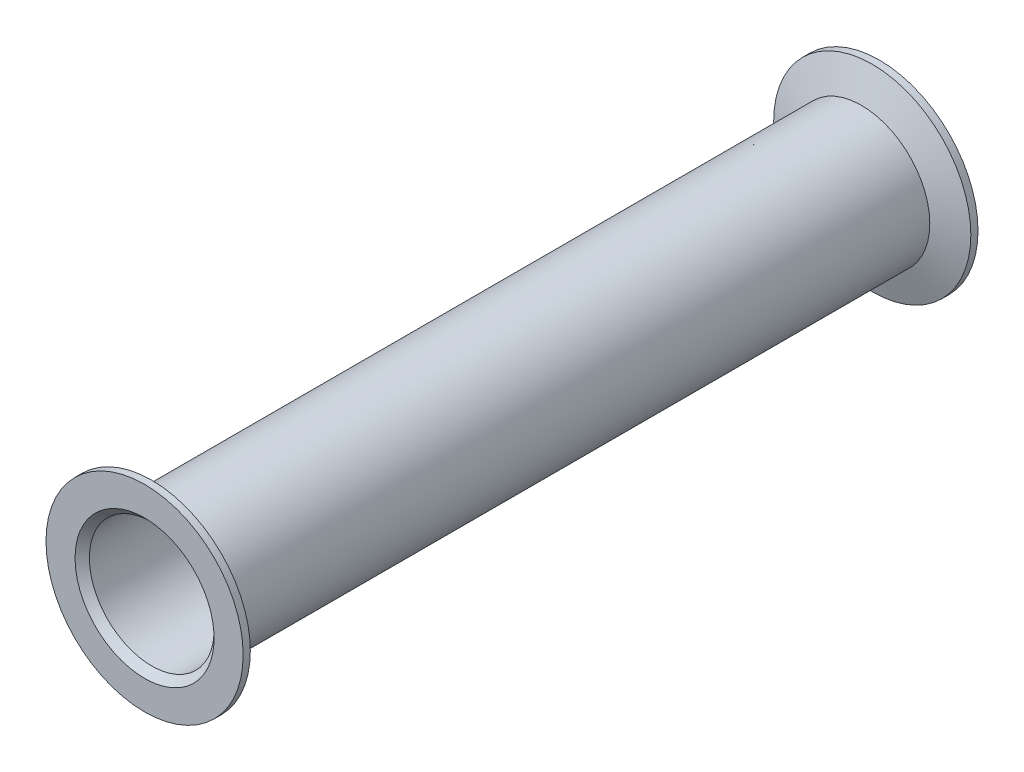
from build123d import *

# Parameters (mm, degrees)
SKETCH_3_R          = 19.05
SKETCH_3_R_2        = 17.4
EXTRUDE_1_DEPTH     = 97.5
SKETCH_5_R          = 17.4
CUT_EXTRUDE_1_DEPTH = 209.656416149
CHAMFER_1_SIZE      = 2


with BuildPart() as part:
    # 스케치3 → 보스-돌출1 (new, symmetric)
    with BuildSketch(Plane.XY):
        Circle(SKETCH_3_R)
        Circle(SKETCH_3_R_2, mode=Mode.SUBTRACT)
    extrude(amount=EXTRUDE_1_DEPTH, both=True)

    # 스케치4 → 회전1 (revolve)
    with BuildSketch(Plane(origin=(0, 0, 0), x_dir=(0, 0, -1), z_dir=(1, 0, 0))):
        Polygon((102.5, 0), (102.5, 27.5), (100.5, 27.5), (97.5, 19.05), (97.5, 0), align=None)
        Polygon((-102.5, 0), (-97.5, 0), (-97.5, 19.05), (-100.5, 27.5), (-102.5, 27.5), align=None)
    revolve(axis=Axis((0, 0, 102.5), (0, 0, -1)))

    # 스케치5 → 컷-돌출1 (cut, through all)
    with BuildSketch(Plane(origin=(0, 0, -102.5), x_dir=(-1, 0, 0), z_dir=(0, 0, -1))):
        Circle(SKETCH_5_R)
    extrude(amount=-CUT_EXTRUDE_1_DEPTH, mode=Mode.SUBTRACT)

    # 모따기1
    chamfer_1_edges = [part.edges().sort_by_distance(p)[0] for p in [
        (17.4, 0, -102.5),
        (17.4, 0, 102.5),
    ]]
    chamfer(chamfer_1_edges, length=CHAMFER_1_SIZE)


solid = part.part
